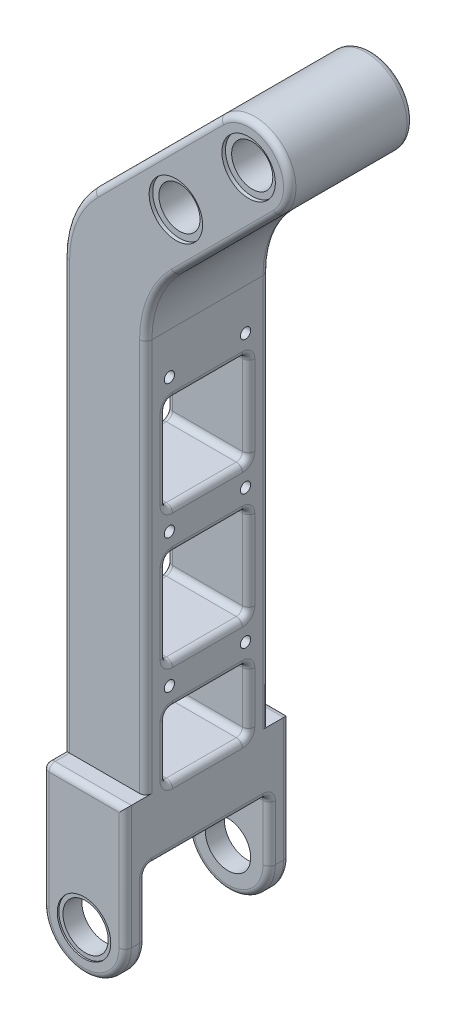
from build123d import *

# Parameters (mm, degrees)
SKETCH_1_R             = 20
SKETCH_1_R_2           = 10
EXTRUDE_1_DEPTH        = 60
EXTRUDE_2_DEPTH        = 30
SKETCH_4_R             = 11
EXTRUDE_3_DEPTH        = 10
SKETCH_8_R             = 10
CUT_EXTRUDE_1_DEPTH    = 100
FILLET_1_R             = 50
FILLET_2_R             = 3
SKETCH_9_R             = 13
CUT_EXTRUDE_2_DEPTH    = 0.75
CUT_EXTRUDE_START      = -0.75
SKETCH_10_R            = 13
CUT_EXTRUDE_3_DEPTH    = 0.75
SKETCH_11_R            = 2.5
CUT_EXTRUDE_4_DEPTH    = 393.300904947
SKETCH_12_W            = 40
SKETCH_12_H            = 45
SKETCH_12_H_2          = 31.005050634
CUT_EXTRUDE_5714_DEPTH = 393.300904947
FILLET_3_R             = 3
SKETCH_13_R            = 13
CUT_EXTRUDE_6_DEPTH    = 1.75
CUT_EXTRUDE_START_2    = -1.75
SKETCH_14_R            = 13
CUT_EXTRUDE_7_DEPTH    = 1.75


with BuildPart() as part:
    # 草图1 → 凸台-拉伸1 (new body)
    with BuildSketch(Plane.XY):
        Circle(SKETCH_1_R)
        Circle(SKETCH_1_R_2, mode=Mode.SUBTRACT)
    extrude(amount=EXTRUDE_1_DEPTH)

    # 草图2 → 凸台-拉伸2 (add, symmetric)
    with BuildSketch(Plane.XY.offset(30)):
        with BuildLine():
            Line((-14.142135624, 14.142135624), (-90, -61.715728753))
            Line((-90, -61.715728753), (-90, -320))
            Line((-90, -320), (-50, -320))
            Line((-50, -320), (-50, -78.284271247))
            Line((-50, -78.284271247), (14.142135624, -14.142135624))
            ThreePointArc((14.142135624, -14.142135624), (-14.142135624, -14.142135624), (-14.142135624, 14.142135624))
        make_face()
    extrude(amount=EXTRUDE_2_DEPTH, both=True)

    # 草图4 → 凸台-拉伸3 (add)
    with BuildSketch(Plane.XY.offset(60)):
        with BuildLine():
            Line((-90, -290), (-50, -290))
            Line((-50, -290), (-50, -350))
            ThreePointArc((-50, -350), (-70, -370), (-90, -350))
            Line((-90, -350), (-90, -290))
        make_face()
        with Locations((-70, -350)):
            Circle(SKETCH_4_R, mode=Mode.SUBTRACT)
    extrude_3 = extrude(amount=EXTRUDE_3_DEPTH)

    # 镜向1: 凸台-拉伸3 across plane
    add(extrude_3.mirror(Plane.XY.offset(30)))

    # 草图8 → 切除-拉伸1 (cut)
    with BuildSketch(Plane.XY.offset(60)):
        with Locations((-35.355339059, -35.355339059)):
            Circle(SKETCH_8_R)
    extrude(amount=-CUT_EXTRUDE_1_DEPTH, mode=Mode.SUBTRACT)

    # 圆角1
    fillet_1_edges = [part.edges().sort_by_distance(p)[0] for p in [
        (-90, -61.715728753, 30),
        (-50, -78.284271247, 30),
    ]]
    fillet(fillet_1_edges, radius=FILLET_1_R)

    # 圆角2
    fillet_2_edges = [part.edges().sort_by_distance(p)[0] for p in [
        (-50, -320, 70),
        (-70, -370, 70),
        (-50, -335, 60),
        (-70, -370, 60),
        (-50, -335, 0),
        (-70, -370, 0),
        (-50, -320, -10),
        (-70, -370, -10),
        (-70, -320, 60),
        (-50, -320, 30),
        (-70, -320, 0),
        (-90, -290, 65),
        (-90, -320, 70),
        (-90, -335, 60),
        (-90, -320, 30),
        (-90, -335, 0),
        (-90, -320, -10),
        (-90, -290, -5),
        (-50, -194.497474683, 0),
        (-46.193976626, -79.860777748, 0),
        (-10.606601718, -38.890872965, 0),
        (14.142135624, 14.142135624, 0),
        (-44.748737342, -16.464466094, 0),
        (-86.193976626, -63.292235253, 0),
        (-90, -186.213203436, 0),
        (14.142135624, 14.142135624, 60),
        (-10.606601718, -38.890872965, 60),
        (-46.193976626, -79.860777748, 60),
        (-50, -194.497474683, 60),
        (-90, -186.213203436, 60),
        (-86.193976626, -63.292235253, 60),
        (-44.748737342, -16.464466094, 60),
        (-70, -290, 70),
        (-70, -290, -10),
    ]]
    fillet(fillet_2_edges, radius=FILLET_2_R)

    # 草图9 → 切除-拉伸2 (cut)
    with BuildSketch(Plane.XY.offset(70)):
        with Locations((-70, -350)):
            Circle(SKETCH_9_R)
    extrude(amount=-CUT_EXTRUDE_2_DEPTH, mode=Mode.SUBTRACT)

    # 草图10 → 切除-拉伸3 (cut)
    with BuildSketch(Plane(origin=(0, 0, -10), x_dir=(-1, 0, 0), z_dir=(0, 0, -1)).offset(CUT_EXTRUDE_START)):
        with Locations((70, -350)):
            Circle(SKETCH_10_R)
    extrude(amount=CUT_EXTRUDE_3_DEPTH, mode=Mode.SUBTRACT)

    # 草图11 → 切除-拉伸4 (cut, through all)
    with BuildSketch(Plane.ZY.offset(90)):
        with Locations((48.5, -118.994949366)):
            Circle(SKETCH_11_R)
        with Locations((48.5, -183.994949366)):
            Circle(SKETCH_11_R)
        with Locations((48.5, -248.994949366)):
            Circle(SKETCH_11_R)
        with Locations((11.5, -248.994949366)):
            Circle(SKETCH_11_R)
        with Locations((11.5, -183.994949366)):
            Circle(SKETCH_11_R)
        with Locations((11.5, -118.994949366)):
            Circle(SKETCH_11_R)
    extrude(amount=-CUT_EXTRUDE_4_DEPTH, mode=Mode.SUBTRACT)

    # 草图12 → Cut-Extrude 5714 (cut, through all)
    with BuildSketch(Plane.ZY.offset(90)):
        with Locations((30, -151.494949366)):
            Rectangle(SKETCH_12_W, SKETCH_12_H)
        with Locations((30, -216.494949366)):
            Rectangle(SKETCH_12_W, SKETCH_12_H)
        with Locations((30, -274.497474683)):
            Rectangle(SKETCH_12_W, SKETCH_12_H_2)
    extrude(amount=-CUT_EXTRUDE_5714_DEPTH, mode=Mode.SUBTRACT)

    # 圆角3
    fillet_3_edges = [part.edges().sort_by_distance(p)[0] for p in [
        (-90, -258.994949366, 30),
        (-50, -258.994949366, 30),
        (-50, -290, 30),
        (-90, -290, 30),
        (-50, -238.994949366, 30),
        (-50, -193.994949366, 30),
        (-90, -193.994949366, 30),
        (-90, -238.994949366, 30),
        (-50, -173.994949366, 30),
        (-90, -173.994949366, 30),
        (-50, -128.994949366, 30),
        (-90, -128.994949366, 30),
        (-70, -290, 10),
        (-90, -274.497474683, 10),
        (-70, -258.994949366, 10),
        (-50, -274.497474683, 10),
        (-50, -274.497474683, 50),
        (-70, -258.994949366, 50),
        (-90, -274.497474683, 50),
        (-70, -290, 50),
        (-50, -216.494949366, 50),
        (-70, -193.994949366, 50),
        (-90, -216.494949366, 50),
        (-70, -238.994949366, 50),
        (-70, -238.994949366, 10),
        (-90, -216.494949366, 10),
        (-70, -193.994949366, 10),
        (-50, -216.494949366, 10),
        (-70, -173.994949366, 10),
        (-90, -151.494949366, 10),
        (-70, -128.994949366, 10),
        (-50, -151.494949366, 10),
        (-50, -151.494949366, 50),
        (-70, -128.994949366, 50),
        (-90, -151.494949366, 50),
        (-70, -173.994949366, 50),
    ]]
    fillet(fillet_3_edges, radius=FILLET_3_R)

    # 草图13 → 切除-拉伸6 (cut)
    with BuildSketch(Plane.XY.offset(60)):
        Circle(SKETCH_13_R)
        with Locations((-35.355339059, -35.355339059)):
            Circle(SKETCH_13_R)
    extrude(amount=-CUT_EXTRUDE_6_DEPTH, mode=Mode.SUBTRACT)

    # 草图14 → 切除-拉伸7 (cut)
    with BuildSketch(Plane(origin=(0, 0, 0), x_dir=(-1, 0, 0), z_dir=(0, 0, -1)).offset(CUT_EXTRUDE_START_2)):
        Circle(SKETCH_14_R)
        with Locations((35.355339059, -35.355339059)):
            Circle(SKETCH_14_R)
    extrude(amount=CUT_EXTRUDE_7_DEPTH, mode=Mode.SUBTRACT)


solid = part.part
